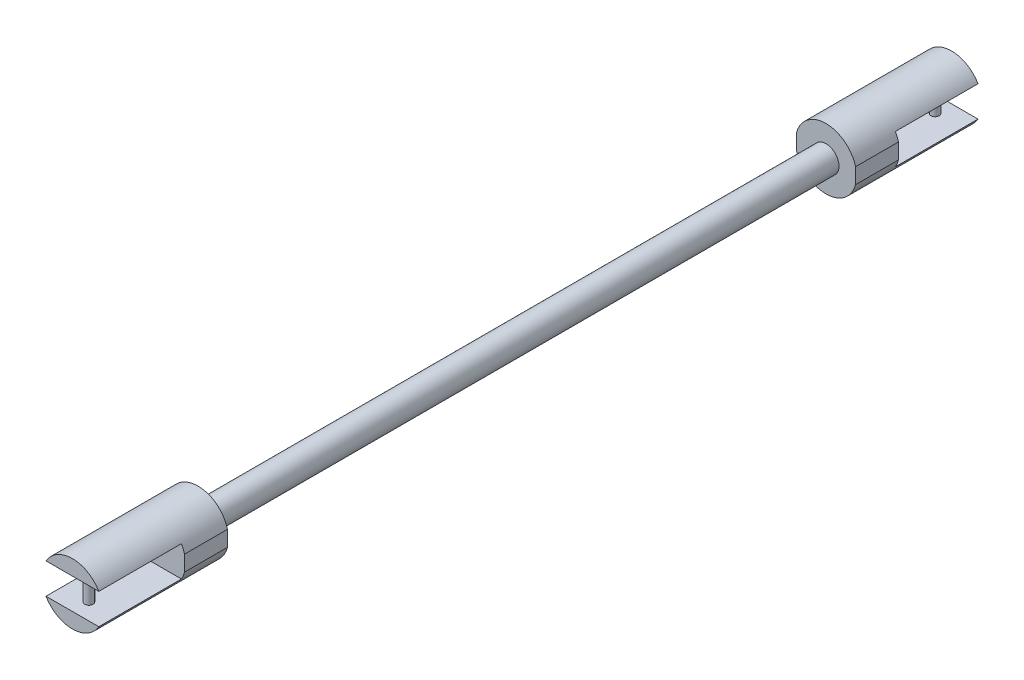
from build123d import *

# Parameters (mm, degrees)
SKETCH1_R           = 2
BOSS_EXTRUDE1_DEPTH = 48.26
SKETCH2_W           = 9.068360996
SKETCH2_H           = 9.379909118
BOSS_EXTRUDE2_DEPTH = 6.604
SKETCH3_W           = 9.068360996
SKETCH3_H           = 2.338852908
BOSS_EXTRUDE3_DEPTH = 12.7
SKETCH5_OUTSIDE_W   = 24.83
SKETCH5_OUTSIDE_H   = 25.142
SKETCH5_OUTSIDE_R   = 4.689954559
CUT_EXTRUDE2_DEPTH  = 68.878189152
SKETCH6_R           = 0.635
BOSS_EXTRUDE4_DEPTH = 4.702203303


# Read off the part's stored shape, not the designer's step: Mirror4
with BuildPart() as part:
    # Sketch1 → Boss-Extrude1 (new body)
    with BuildSketch(Plane.XY):
        with Locations(Location((0, 0, 0), (0, 0, 180))):
            Circle(SKETCH1_R)
    extrude(amount=BOSS_EXTRUDE1_DEPTH)

    # Sketch2 → Boss-Extrude2 (add)
    with BuildSketch(Plane.XY.offset(48.26)):
        Rectangle(SKETCH2_W, SKETCH2_H)
    extrude(amount=BOSS_EXTRUDE2_DEPTH)

    # Sketch3 → Boss-Extrude3 (add)
    with BuildSketch(Plane.XY.offset(54.864)):
        with Locations((0, 3.520528105)):
            Rectangle(SKETCH3_W, SKETCH3_H)
    boss_extrude3 = extrude(amount=BOSS_EXTRUDE3_DEPTH)

    # Mirror1: Boss-Extrude3 across plane
    add(boss_extrude3.mirror(Plane.ZX))

    # Sketch5 outside → Cut-Extrude2 (cut, through all)
    with BuildSketch(Plane.XY.offset(67.564)):
        Rectangle(SKETCH5_OUTSIDE_W, SKETCH5_OUTSIDE_H)
        Circle(SKETCH5_OUTSIDE_R, mode=Mode.SUBTRACT)
    extrude(amount=-CUT_EXTRUDE2_DEPTH, mode=Mode.SUBTRACT)

    # Sketch6 → Boss-Extrude4 (add)
    with BuildSketch(Plane(origin=(0, -2.351101651, 0), x_dir=(1, 0, 0), z_dir=(0, 1, 0))):
        with Locations(Location((0, -65.024, 0), (0, 0, 270))):
            Circle(SKETCH6_R)
    extrude(amount=BOSS_EXTRUDE4_DEPTH)

    # Mirror4: part across plane


with BuildPart() as part_1:
    add(part.part)
    add(part.part.mirror(Plane(origin=(0, 0, 0), x_dir=(1, 0, 0), z_dir=(0, 0, -1))))


solid = part_1.part
